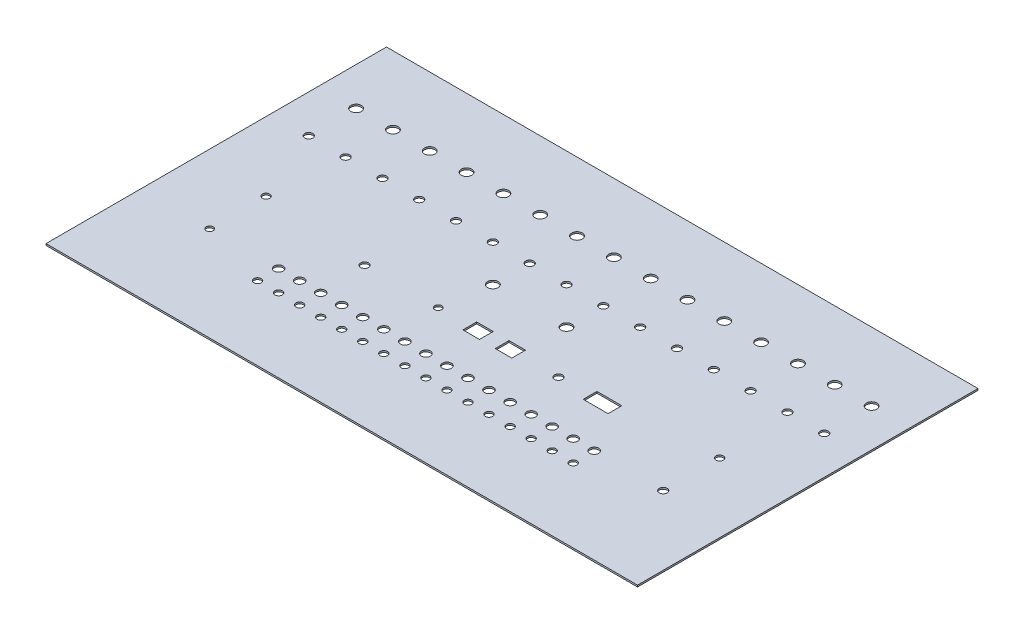
from build123d import *

# Parameters (mm, degrees)
SKETCH1_W            = 562.3
SKETCH1_H            = 323.65
BOSS_EXTRUDE1_DEPTH  = 1.5875
CUT_EXTRUDE2_REACH   = 326.4
SKETCH6_R            = 3.5
LPATTERN2_COUNT      = 16
LPATTERN2_PITCH      = 20
CUT_EXTRUDE3_REACH   = 326.4
SKETCH7_R            = 4.25
LPATTERN3_COUNT      = 16
LPATTERN3_PITCH      = 20
CUT_EXTRUDE4_REACH   = 326.4
SKETCH8_R            = 3.3
CUT_EXTRUDE7_REACH   = 326.4
SKETCH15_W           = 23.61
SKETCH15_H           = 13.08
CUT_EXTRUDE8_REACH   = 326.4
SKETCH16_R           = 3.3
CUT_EXTRUDE9_REACH   = 326.4
SKETCH18_W           = 15.74
SKETCH18_H           = 13.08
CUT_EXTRUDE10_REACH  = 326.4
SKETCH19_W           = 15.74
SKETCH19_H           = 13.08
CUT_EXTRUDE12_REACH  = 326.4
SKETCH24_R           = 3.5
CUT_EXTRUDE13_REACH  = 326.4
SKETCH26_R           = 3.5
M7_CLEARANCE_HOLE1_D = 7.6
LPATTERN4_COUNT      = 15
LPATTERN4_PITCH      = 35
CUT_EXTRUDE14_REACH  = 326.4
SKETCH33_R           = 5
LPATTERN5_COUNT      = 15
LPATTERN5_PITCH      = 35
CUT_EXTRUDE15_REACH  = 326.4
SKETCH34_R           = 5
LPATTERN6_COUNT      = 2
LPATTERN6_PITCH      = 70
M7_CLEARANCE_HOLE3_D = 7.6
M7_CLEARANCE_HOLE4_D = 7.6
M7_CLEARANCE_HOLE5_D = 7.6


with BuildPart() as part:
    # Sketch1 → Boss-Extrude1 (new body)
    with BuildSketch(Plane(origin=(0, 0, 0), x_dir=(1, 0, 0), z_dir=(0, 1, 0))):
        Rectangle(SKETCH1_W, SKETCH1_H)
    extrude(amount=BOSS_EXTRUDE1_DEPTH)

    # Sketch6 → Cut-Extrude2 (cut, up to next)
    with BuildSketch(Plane(origin=(0, 1.5875, 0), x_dir=(1, 0, 0), z_dir=(0, 1, 0)), mode=Mode.PRIVATE) as cut_extrude2_sk1:
        with Locations((-150, -91.825)):
            Circle(SKETCH6_R)
    cut_extrude2_tool1 = extrude(cut_extrude2_sk1.sketch, amount=-CUT_EXTRUDE2_REACH, mode=Mode.PRIVATE) & part.part
    cut_extrude2 = cut_extrude2_tool1.solids().sort_by_distance((-150, 1.5875, 91.825))[0]
    add(cut_extrude2, mode=Mode.SUBTRACT)

    # LPattern2: Cut-Extrude2 ×16
    with Locations(*[(i * LPATTERN2_PITCH, 0, 0) for i in range(1, LPATTERN2_COUNT)]):
        add(cut_extrude2, mode=Mode.SUBTRACT)

    # Sketch7 → Cut-Extrude3 (cut, up to next)
    with BuildSketch(Plane(origin=(0, 1.5875, 0), x_dir=(1, 0, 0), z_dir=(0, 1, 0)), mode=Mode.PRIVATE) as cut_extrude3_sk1:
        with Locations((-150, -71.825)):
            Circle(SKETCH7_R)
    cut_extrude3_tool1 = extrude(cut_extrude3_sk1.sketch, amount=-CUT_EXTRUDE3_REACH, mode=Mode.PRIVATE) & part.part
    cut_extrude3 = cut_extrude3_tool1.solids().sort_by_distance((-150, 1.5875, 71.825))[0]
    add(cut_extrude3, mode=Mode.SUBTRACT)

    # LPattern3: Cut-Extrude3 ×16
    with Locations(*[(i * LPATTERN3_PITCH, 0, 0) for i in range(1, LPATTERN3_COUNT)]):
        add(cut_extrude3, mode=Mode.SUBTRACT)

    # Sketch8 → Cut-Extrude4 (cut, up to next)
    with BuildSketch(Plane(origin=(0, 1.5875, 0), x_dir=(1, 0, 0), z_dir=(0, 1, 0)), mode=Mode.PRIVATE) as cut_extrude4_sk1:
        with Locations((-215.575, -71.825)):
            Circle(SKETCH8_R)
    cut_extrude4_tool1 = extrude(cut_extrude4_sk1.sketch, amount=-CUT_EXTRUDE4_REACH, mode=Mode.PRIVATE) & part.part
    add(cut_extrude4_tool1.solids().sort_by_distance((-215.575, 1.5875, 71.825))[0], mode=Mode.SUBTRACT)

    # Sketch15 → Cut-Extrude7 (cut, up to next)
    with BuildSketch(Plane(origin=(0, 1.5875, 0), x_dir=(1, 0, 0), z_dir=(0, 1, 0)), mode=Mode.PRIVATE) as cut_extrude7_sk1:
        with Locations((114.202396417, -28.175)):
            Rectangle(SKETCH15_W, SKETCH15_H)
    cut_extrude7_tool1 = extrude(cut_extrude7_sk1.sketch, amount=-CUT_EXTRUDE7_REACH, mode=Mode.PRIVATE) & part.part
    add(cut_extrude7_tool1.solids().sort_by_distance((114.202396, 1.5875, 28.175))[0], mode=Mode.SUBTRACT)

    # Sketch16 → Cut-Extrude8 (cut, up to next)
    with BuildSketch(Plane(origin=(0, 1.5875, 0), x_dir=(1, 0, 0), z_dir=(0, 1, 0)), mode=Mode.PRIVATE) as cut_extrude8_sk1:
        with Locations((-41.952521652, -28.175)):
            Circle(SKETCH16_R)
    cut_extrude8_tool1 = extrude(cut_extrude8_sk1.sketch, amount=-CUT_EXTRUDE8_REACH, mode=Mode.PRIVATE) & part.part
    add(cut_extrude8_tool1.solids().sort_by_distance((-41.952522, 1.5875, 28.175))[0], mode=Mode.SUBTRACT)

    # Sketch18 → Cut-Extrude9 (cut, up to next)
    with BuildSketch(Plane(origin=(0, 1.5875, 0), x_dir=(1, 0, 0), z_dir=(0, 1, 0)), mode=Mode.PRIVATE) as cut_extrude9_sk1:
        with Locations((-4.082521652, -28.175)):
            Rectangle(SKETCH18_W, SKETCH18_H)
    cut_extrude9_tool1 = extrude(cut_extrude9_sk1.sketch, amount=-CUT_EXTRUDE9_REACH, mode=Mode.PRIVATE) & part.part
    add(cut_extrude9_tool1.solids().sort_by_distance((-4.082522, 1.5875, 28.175))[0], mode=Mode.SUBTRACT)

    # Sketch19 → Cut-Extrude10 (cut, up to next)
    with BuildSketch(Plane(origin=(0, 1.5875, 0), x_dir=(1, 0, 0), z_dir=(0, 1, 0)), mode=Mode.PRIVATE) as cut_extrude10_sk1:
        with Locations((26.657478348, -28.175)):
            Rectangle(SKETCH19_W, SKETCH19_H)
    cut_extrude10_tool1 = extrude(cut_extrude10_sk1.sketch, amount=-CUT_EXTRUDE10_REACH, mode=Mode.PRIVATE) & part.part
    add(cut_extrude10_tool1.solids().sort_by_distance((26.657478, 1.5875, 28.175))[0], mode=Mode.SUBTRACT)

    # Sketch24 → Cut-Extrude12 (cut, up to next)
    with BuildSketch(Plane(origin=(0, 1.5875, 0), x_dir=(1, 0, 0), z_dir=(0, 1, 0)), mode=Mode.PRIVATE) as cut_extrude12_sk1:
        with Locations((-215.57, -18.175)):
            Circle(SKETCH24_R)
    cut_extrude12_tool1 = extrude(cut_extrude12_sk1.sketch, amount=-CUT_EXTRUDE12_REACH, mode=Mode.PRIVATE) & part.part
    add(cut_extrude12_tool1.solids().sort_by_distance((-215.57, 1.5875, 18.175))[0], mode=Mode.SUBTRACT)

    # Sketch26 → Cut-Extrude13 (cut, up to next)
    with BuildSketch(Plane(origin=(0, 1.5875, 0), x_dir=(1, 0, 0), z_dir=(0, 1, 0)), mode=Mode.PRIVATE) as cut_extrude13_sk1:
        with Locations((215.57, -18.175)):
            Circle(SKETCH26_R)
    cut_extrude13_tool1 = extrude(cut_extrude13_sk1.sketch, amount=-CUT_EXTRUDE13_REACH, mode=Mode.PRIVATE) & part.part
    add(cut_extrude13_tool1.solids().sort_by_distance((215.57, 1.5875, 18.175))[0], mode=Mode.SUBTRACT)

    # M7 Clearance Hole1 (through all)
    with Locations(Plane(origin=(0, 1.5875, 0), x_dir=(1, 0, 0), z_dir=(0, 1, 0))):
        with Locations((-245, 51.825)):
            m7_clearance_hole1 = Hole(M7_CLEARANCE_HOLE1_D / 2)

    # LPattern4: M7 Clearance Hole1 ×15
    with Locations(*[(i * LPATTERN4_PITCH, 0, 0) for i in range(1, LPATTERN4_COUNT)]):
        add(m7_clearance_hole1, mode=Mode.SUBTRACT)

    # Sketch33 → Cut-Extrude14 (cut, up to next)
    with BuildSketch(Plane(origin=(0, 1.5875, 0), x_dir=(1, 0, 0), z_dir=(0, 1, 0)), mode=Mode.PRIVATE) as cut_extrude14_sk1:
        with Locations((-245, 96.825)):
            Circle(SKETCH33_R)
    cut_extrude14_tool1 = extrude(cut_extrude14_sk1.sketch, amount=-CUT_EXTRUDE14_REACH, mode=Mode.PRIVATE) & part.part
    cut_extrude14 = cut_extrude14_tool1.solids().sort_by_distance((-245, 1.5875, -96.825))[0]
    add(cut_extrude14, mode=Mode.SUBTRACT)

    # LPattern5: Cut-Extrude14 ×15
    with Locations(*[(i * LPATTERN5_PITCH, 0, 0) for i in range(1, LPATTERN5_COUNT)]):
        add(cut_extrude14, mode=Mode.SUBTRACT)

    # Sketch34 → Cut-Extrude15 (cut, up to next)
    with BuildSketch(Plane(origin=(0, 1.5875, 0), x_dir=(1, 0, 0), z_dir=(0, 1, 0)), mode=Mode.PRIVATE) as cut_extrude15_sk1:
        with Locations((-35, 16.825)):
            Circle(SKETCH34_R)
    cut_extrude15_tool1 = extrude(cut_extrude15_sk1.sketch, amount=-CUT_EXTRUDE15_REACH, mode=Mode.PRIVATE) & part.part
    cut_extrude15 = cut_extrude15_tool1.solids().sort_by_distance((-35, 1.5875, -16.825))[0]
    add(cut_extrude15, mode=Mode.SUBTRACT)

    # LPattern6: Cut-Extrude15 ×2
    with Locations(*[(i * LPATTERN6_PITCH, 0, 0) for i in range(1, LPATTERN6_COUNT)]):
        add(cut_extrude15, mode=Mode.SUBTRACT)

    # M7 Clearance Hole3 (through all)
    with Locations(Plane(origin=(0, 1.5875, 0), x_dir=(1, 0, 0), z_dir=(0, 1, 0))):
        with Locations((72.397396417, -28.165)):
            Hole(M7_CLEARANCE_HOLE3_D / 2)

    # M7 Clearance Hole4 (through all)
    with Locations(Plane(origin=(0, 1.5875, 0), x_dir=(1, 0, 0), z_dir=(0, 1, 0))):
        with Locations((-111.952521652, -28.175)):
            Hole(M7_CLEARANCE_HOLE4_D / 2)

    # M7 Clearance Hole5 (through all)
    with Locations(Plane(origin=(0, 1.5875, 0), x_dir=(1, 0, 0), z_dir=(0, 1, 0))):
        with Locations((215.57, -71.825)):
            Hole(M7_CLEARANCE_HOLE5_D / 2)


solid = part.part
